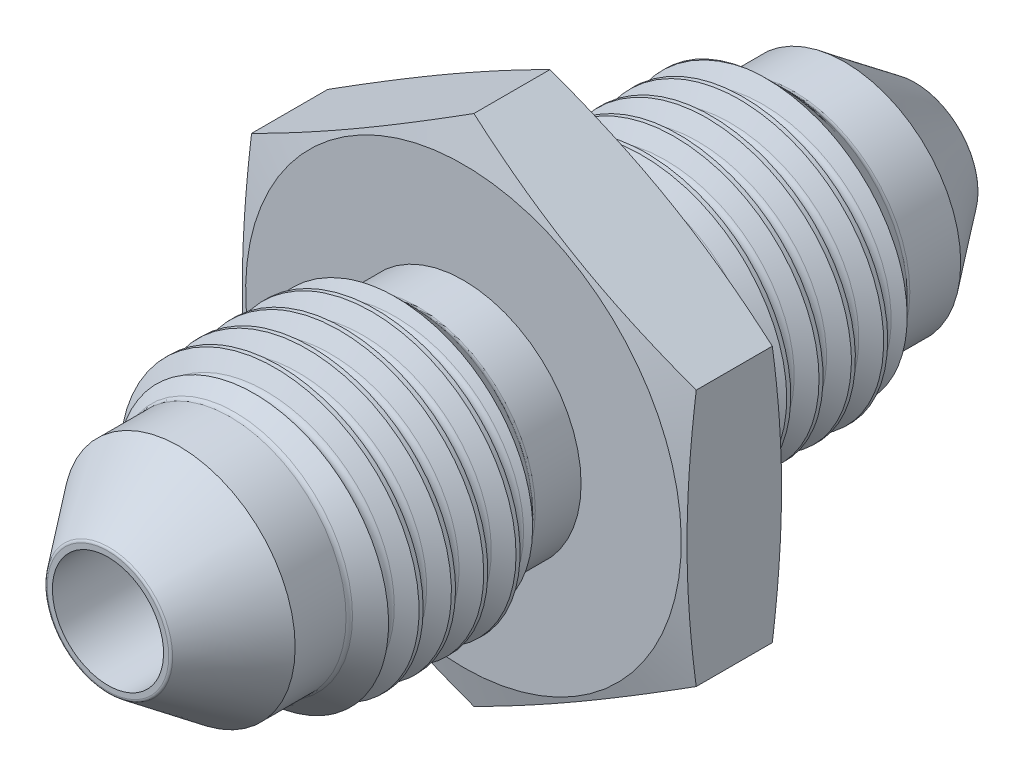
from build123d import *
from build123d.topology import SkipClean

# Parameters (mm, degrees)
CUT_SWEEP1_PITCH         = 1.27
CIRPATTERN1_COUNT        = 2
CIRPATTERN1_ANGLE        = 180
BOSS_EXTRUDE1_DEPTH      = 1.905
BOSS_EXTRUDE1_DEPTH_BACK = 1.905
CIRPATTERN2_COUNT        = 2
CIRPATTERN2_ANGLE        = 180


with BuildPart() as part:
    # Sketch1 → Revolve1 (revolve)
    with BuildSketch(Plane(origin=(0, 0, 0), x_dir=(0, 0, -1), z_dir=(1, 0, 0)), mode=Mode.PRIVATE) as revolve1_sk:
        with BuildLine():
            Line((-15.875, 0), (0, 0))
            Line((0, 0), (0, 4.6228))
            Line((0, 4.6228), (-3.704789755, 4.6228))
            ThreePointArc((-3.704789755, 4.6228), (-3.801991347, 4.642134599), (-3.884394878, 4.697194878))
            Line((-3.884394878, 4.697194878), (-4.74345, 5.55625))
            Line((-4.74345, 5.55625), (-9.97585, 5.55625))
            Line((-9.97585, 5.55625), (-10.898405122, 4.633694878))
            ThreePointArc((-10.898405122, 4.633694878), (-10.980808653, 4.578634599), (-11.078010245, 4.5593))
            Line((-11.078010245, 4.5593), (-13.077324107, 4.5593))
            Line((-13.077324107, 4.5593), (-15.824430508, 2.489206846))
            ThreePointArc((-15.824430508, 2.489206846), (-15.861656664, 2.444447258), (-15.875, 2.387780136))
            Line((-15.875, 2.387780136), (-15.875, 0))
        make_face()
    revolve(revolve1_sk.sketch.rotate(Axis((0, 0, 19.812), (0, 0, -1)), 90), axis=Axis((0, 0, 19.812), (0, 0, -1)))

    # Cut-Sweep1: the profile of Sketch3 screwed along a right-hand helix of 12 turns, 8 arcs to a turn; built about Z, then put on its axis
    cut_sweep1_z = Axis((0, 0, 0), (0, 0, 1))
    cut_sweep1_corners = [(5.624990766, 0, -1.1509375), (4.937583102, 0, -0.7540625), (4.823015158, 0, -0.555625), (4.937583102, 0, -0.3571875), (5.624990766, 0, 0.0396875)]
    with BuildLine(mode=Mode.PRIVATE) as cut_sweep1_profile:
        Line(cut_sweep1_corners[0], cut_sweep1_corners[1])
        Line(cut_sweep1_corners[3], cut_sweep1_corners[4])
        Line(cut_sweep1_corners[4], cut_sweep1_corners[0])
        ThreePointArc((4.937583102, 0, -0.7540625), (4.853713546, 0, -0.670192944), (4.823015158, 0, -0.555625))
        ThreePointArc((4.823015158, 0, -0.555625), (4.853713546, 0, -0.441057056), (4.937583102, 0, -0.3571875))
    cut_sweep1_cap = Face(cut_sweep1_profile.wire())
    cut_sweep1_arcs = [((4.937583102, 0, -0.7540625), (4.823015158, 0, -0.687916667), (4.823015158, 0, -0.555625), (1, 0.8660254037844357, 1)), ((4.823015158, 0, -0.555625), (4.823015158, 0, -0.423333333), (4.937583102, 0, -0.3571875), (1, 0.8660254037844357, 1))]  # start, shoulder, end, weights
    cut_sweep1_turn_angles = [0, 22.5, 45, 67.5, 90, 112.5, 135, 157.5, 180, 202.5, 225, 247.5, 270, 292.5, 315, 337.5, 360]
    cut_sweep1_turn_weights = [1, 0.9238795325112867, 1, 0.9238795325112867, 1, 0.9238795325112867, 1, 0.9238795325112867, 1, 0.9238795325112867, 1, 0.9238795325112867, 1, 0.9238795325112867, 1, 0.9238795325112867, 1]
    cut_sweep1_turn_rails = [Edge.make_bspline([Vector(p[0], p[1], 0).rotate(cut_sweep1_z, cut_sweep1_turn_angles[k]) / cut_sweep1_turn_weights[k] + Vector(0, 0, p[2] + CUT_SWEEP1_PITCH * cut_sweep1_turn_angles[k] / 360) for k in range(17)], [0, 0, 0, 1, 1, 2, 2, 3, 3, 4, 4, 5, 5, 6, 6, 7, 7, 8, 8, 8], 2, cut_sweep1_turn_weights) for p in cut_sweep1_corners]
    cut_sweep1_turn_sides = [*[Face.make_surface_from_curves(cut_sweep1_turn_rails[p[0]], cut_sweep1_turn_rails[p[1]]) for p in [(0, 1), (3, 4), (4, 0)]], *[Face.make_bezier_surface([[Vector(p[j][0], p[j][1], 0).rotate(cut_sweep1_z, cut_sweep1_turn_angles[2 * i + k]) / cut_sweep1_turn_weights[2 * i + k] + Vector(0, 0, p[j][2] + CUT_SWEEP1_PITCH * cut_sweep1_turn_angles[2 * i + k] / 360) for k in range(3)] for j in range(3)], [[p[3][j] * cut_sweep1_turn_weights[2 * i + k] for k in range(3)] for j in range(3)]) for p in cut_sweep1_arcs for i in range(8)]]
    cut_sweep1 = Plane(origin=(0, 0, 15.875), x_dir=(0, 1, 0), z_dir=(0, 0, -1)) * Solid(Shell([*[p.moved(Location((0, 0, CUT_SWEEP1_PITCH * i))) for i in range(12) for p in cut_sweep1_turn_sides], cut_sweep1_cap, cut_sweep1_cap.rotate(cut_sweep1_z, 4320).moved(Location((0, 0, CUT_SWEEP1_PITCH * 4320 / 360)))]))
    add(cut_sweep1, mode=Mode.SUBTRACT)


with BuildPart() as cirpattern1_1:
    # CirPattern1: pattern copy
    add(part.part.rotate(Axis((-10.4775, 0, 0), (1, 0, 0)), 1 * CIRPATTERN1_ANGLE / (CIRPATTERN1_COUNT - 1)))


with BuildPart() as part_1:
    add(part.part)

    add(cirpattern1_1.part)  # Boss-Extrude1 merges CirPattern1_1
    # Sketch4 → Boss-Extrude1 (add, two sides: drawn at the far end of the back side and taken through both)
    with BuildSketch(Plane.XY.offset(-BOSS_EXTRUDE1_DEPTH_BACK)):
        Polygon((0, 10.089311424), (-8.7376, 5.044655712), (-8.7376, -5.044655712), (0, -10.089311424), (8.7376, -5.044655712), (8.7376, 5.044655712), align=None)
    extrude(amount=BOSS_EXTRUDE1_DEPTH + BOSS_EXTRUDE1_DEPTH_BACK)

    # Sketch5 → Cut-Revolve1 (revolve, cut)
    with BuildSketch(Plane(origin=(0, 0, 0), x_dir=(0, 0, -1), z_dir=(1, 0, 0)), mode=Mode.PRIVATE) as cut_revolve1_sk:
        Polygon((-1.905, 11.618822848), (1.905, 11.618822848), (1.905, 8.5598), (1.495168649, 10.089311424), (-1.495168649, 10.089311424), (-1.905, 8.5598), align=None)
    revolve(cut_revolve1_sk.sketch.rotate(Axis((0, 0, 1.905), (0, 0, -1)), 269.389710939), axis=Axis((0, 0, 1.905), (0, 0, -1)), mode=Mode.SUBTRACT)

    # Sketch6 → Cut-Revolve2 (revolve, cut)
    with BuildSketch(Plane(origin=(0, 0, 0), x_dir=(0, 0, -1), z_dir=(1, 0, 0)), mode=Mode.PRIVATE) as cut_revolve2_sk:
        with BuildLine():
            Line((-15.875, 2.1844), (0, 2.1844))
            ThreePointArc((0, 2.1844), (1.544604053, 1.544604053), (2.1844, 0))
            Line((2.1844, 0), (-15.875, 0))
            Line((-15.875, 0), (-15.875, 2.1844))
        make_face()
    cut_revolve2 = revolve(cut_revolve2_sk.sketch.rotate(Axis((0, 0, -2.1844), (0, 0, 1)), 90.610289061), axis=Axis((0, 0, -2.1844), (0, 0, 1)), mode=Mode.SUBTRACT)

    # CirPattern2: Cut-Revolve2 ×2 about axis
    with SkipClean():  # the faces are left unmerged after this step: merging them gives an invalid solid
        cirpattern2_axis = Axis((-10.4775, 0, 0), (1, 0, 0))
        for i in range(1, CIRPATTERN2_COUNT):
            add(cut_revolve2.rotate(cirpattern2_axis, i * CIRPATTERN2_ANGLE / (CIRPATTERN2_COUNT - 1)), mode=Mode.SUBTRACT)


solid = part_1.part
